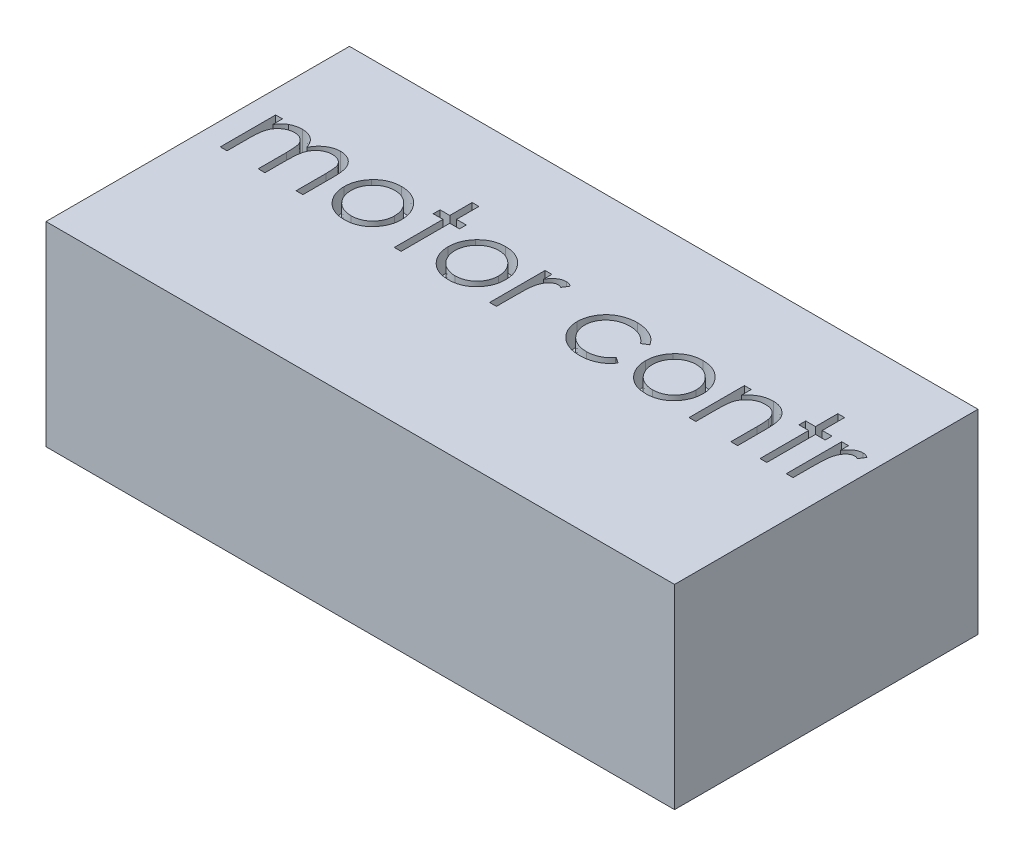
from build123d import *

# Parameters (mm, degrees)
SKETCH1_W           = 29
SKETCH1_H           = 14
BOSS_EXTRUDE1_DEPTH = 9
CUT_EXTRUDE1_DEPTH  = 1


with BuildPart() as part:
    # Sketch1 → Boss-Extrude1 (new body)
    with BuildSketch(Plane(origin=(0, 0, 0), x_dir=(1, 0, 0), z_dir=(0, 1, 0))):
        Rectangle(SKETCH1_W, SKETCH1_H)
    extrude(amount=BOSS_EXTRUDE1_DEPTH)

    # Sketch2 → Cut-Extrude1 (cut)
    # profile 1 of 10: a face of its own
    with BuildSketch(Plane(origin=(0, 9, 0), x_dir=(1, 0, 0), z_dir=(0, 1, 0))):
        with BuildLine():
            Line((-13.461538462, 2.557692308), (-13.147435897, 2.557692308))
            Line((-13.147435897, 2.557692308), (-13.147435897, 2.11318109))
            add(Edge.make_bspline(
                [(-13.147435897, 2.11318109), (-13.119151948, 2.152068691), (-13.064957188, 2.226581065), (-12.976091535, 2.324771349), (-12.887315423, 2.408099503), (-12.823382041, 2.451842375), (-12.792668269, 2.472856571)],
                knots=[0, 0, 0, 0, 1.134379233, 2.173579362, 3.122582517, 4, 4, 4, 4], degree=3))
            add(Edge.make_bspline(
                [(-12.792668269, 2.472856571), (-12.750803607, 2.492861936), (-12.667805707, 2.532523149), (-12.536386482, 2.572756708), (-12.401911813, 2.597481809), (-12.311103599, 2.600863183), (-12.265424679, 2.602564103)],
                knots=[0, 0, 0, 0, 1.014936303, 2.012140481, 3.000054389, 4, 4, 4, 4], degree=3))
            add(Edge.make_bspline(
                [(-12.265424679, 2.602564103), (-12.234531683, 2.601518812), (-12.173396104, 2.599450238), (-12.082812014, 2.585990202), (-11.994953402, 2.562724029), (-11.910339373, 2.530316705), (-11.830618693, 2.491070018), (-11.757529496, 2.445020311), (-11.691905287, 2.393323235), (-11.633779236, 2.333644302), (-11.581510211, 2.264307704), (-11.533431364, 2.183443455), (-11.489006152, 2.089235794), (-11.464384843, 2.020869253), (-11.451422276, 1.984875801)],
                knots=[0, 0, 0, 0, 1.009824226, 1.998387844, 2.986035974, 3.974953746, 4.955485308, 5.885931332, 6.793869504, 7.679848016, 8.601185859, 9.625726857, 10.749998409, 12, 12, 12, 12], degree=3))
            add(Edge.make_bspline(
                [(-11.451422276, 1.984875801), (-11.437711024, 2.009600221), (-11.410729207, 2.058254406), (-11.36542357, 2.127112668), (-11.317955774, 2.19151946), (-11.267921281, 2.251525884), (-11.215496694, 2.306835614), (-11.160435293, 2.357631516), (-11.103050512, 2.40413173), (-11.023258272, 2.458454889), (-10.919445665, 2.516156071), (-10.78855755, 2.566184515), (-10.652407378, 2.597100643), (-10.55998968, 2.600730916), (-10.513321314, 2.602564103)],
                knots=[0, 0, 0, 0, 0.86119277, 1.694706429, 2.50939023, 3.298075842, 4.073795165, 4.829715201, 5.57930267, 6.321991688, 7.768977793, 9.186738141, 10.579381044, 12, 12, 12, 12], degree=3))
            add(Edge.make_bspline(
                [(-10.513321314, 2.602564103), (-10.470439851, 2.600946882), (-10.386516665, 2.597781823), (-10.264339399, 2.57292835), (-10.150397594, 2.530250703), (-10.044920518, 2.472017066), (-9.949760704, 2.398837883), (-9.867044395, 2.311769046), (-9.797274032, 2.211426423), (-9.751695392, 2.117034434), (-9.720780128, 2.033699101), (-9.701718894, 1.96269281), (-9.684879199, 1.884541257), (-9.670897953, 1.799150995), (-9.660679401, 1.706220387), (-9.653108686, 1.605901511), (-9.647984612, 1.498116399), (-9.64762254, 1.423750899), (-9.647435897, 1.385416667)],
                knots=[0, 0, 0, 0, 1.209669288, 2.367440248, 3.500751976, 4.631527125, 5.755587489, 6.87532382, 8.007944318, 9.190864318, 9.82315674, 10.514484317, 11.263564316, 12.079023757, 12.955305781, 13.901327259, 14.918167583, 16, 16, 16, 16], degree=3))
            Line((-9.647435897, 1.385416667), (-9.647435897, 0))
            Line((-9.647435897, 0), (-9.961538462, 0))
            Line((-9.961538462, 0), (-9.961538462, 1.38681891))
            add(Edge.make_bspline(
                [(-9.961538462, 1.38681891), (-9.961616345, 1.419539484), (-9.961766024, 1.482423451), (-9.964459655, 1.572675902), (-9.969534969, 1.654944259), (-9.975469608, 1.729116348), (-9.983713418, 1.795365136), (-9.994359349, 1.853557555), (-10.005637029, 1.904151366), (-10.02437302, 1.960237414), (-10.054320912, 2.022107624), (-10.099938392, 2.0888312), (-10.157408498, 2.146912), (-10.223768655, 2.197330317), (-10.299317099, 2.238323958), (-10.382581823, 2.267599968), (-10.473045874, 2.285722846), (-10.535668663, 2.287528862), (-10.568008814, 2.288461538)],
                knots=[0, 0, 0, 0, 1.253487763, 2.409012846, 3.458416907, 4.410876679, 5.259312806, 6.014470957, 6.676830364, 7.243083969, 8.276244668, 9.299465089, 10.325150304, 11.392391894, 12.482080715, 13.603491619, 14.762376348, 16, 16, 16, 16], degree=3))
            add(Edge.make_bspline(
                [(-10.568008814, 2.288461538), (-10.607678768, 2.287045381), (-10.68608168, 2.284246516), (-10.800527166, 2.255672643), (-10.910498182, 2.212592392), (-11.012713315, 2.150159935), (-11.106741106, 2.075351571), (-11.187640684, 1.986401975), (-11.254472869, 1.885772048), (-11.299726845, 1.792625346), (-11.328316147, 1.708955902), (-11.347193062, 1.63585853), (-11.361876454, 1.552776962), (-11.375646983, 1.460269472), (-11.384634711, 1.357699291), (-11.392803083, 1.24554089), (-11.396623946, 1.123456931), (-11.397158405, 1.038830242), (-11.397435897, 0.994891827)],
                knots=[0, 0, 0, 0, 1.090531906, 2.155305635, 3.229839962, 4.33261226, 5.44038871, 6.529323825, 7.629011124, 8.757537029, 9.370236727, 10.061839251, 10.834451254, 11.692844982, 12.636905849, 13.66920014, 14.789842145, 16, 16, 16, 16], degree=3))
            Line((-11.397435897, 0.994891827), (-11.397435897, 0))
            Line((-11.397435897, 0), (-11.711538462, 0))
            Line((-11.711538462, 0), (-11.711538462, 1.300580929))
            add(Edge.make_bspline(
                [(-11.711538462, 1.300580929), (-11.711617893, 1.337274248), (-11.71177071, 1.407868505), (-11.714447027, 1.509102181), (-11.719533649, 1.601183261), (-11.725414197, 1.684004725), (-11.733874376, 1.757416053), (-11.743484138, 1.821810811), (-11.754832748, 1.877027563), (-11.773622633, 1.937590947), (-11.802337101, 2.00431187), (-11.848525363, 2.075452892), (-11.906132944, 2.137720989), (-11.973703819, 2.190879738), (-12.049709502, 2.234821219), (-12.133692902, 2.266480971), (-12.224897815, 2.28490526), (-12.287775521, 2.287253757), (-12.320112179, 2.288461538)],
                knots=[0, 0, 0, 0, 1.320475261, 2.540461679, 3.643808994, 4.639130445, 5.527981419, 6.302341397, 6.981980563, 7.553956391, 8.582137848, 9.585246428, 10.591171744, 11.620968678, 12.668337649, 13.738356861, 14.836885341, 16, 16, 16, 16], degree=3))
            add(Edge.make_bspline(
                [(-12.320112179, 2.288461538), (-12.358128391, 2.286931078), (-12.43389335, 2.283880926), (-12.54519532, 2.256426652), (-12.652681004, 2.213422577), (-12.754635702, 2.153762758), (-12.848309851, 2.07986368), (-12.930318118, 1.992948784), (-12.999260644, 1.89409975), (-13.044992458, 1.801935234), (-13.074490933, 1.720361959), (-13.094086267, 1.651011011), (-13.110925893, 1.574010763), (-13.123439915, 1.489123652), (-13.13552033, 1.396902558), (-13.141350639, 1.296888068), (-13.147022202, 1.18916598), (-13.147294616, 1.114793435), (-13.147435897, 1.076221955)],
                knots=[0, 0, 0, 0, 1.098833095, 2.189935336, 3.297829714, 4.440610912, 5.596351641, 6.740013378, 7.886572111, 9.072425424, 9.705826452, 10.395263256, 11.156850408, 11.985370555, 12.878090359, 13.847760091, 14.883794034, 16, 16, 16, 16], degree=3))
            Line((-13.147435897, 1.076221955), (-13.147435897, 0))
            Line((-13.147435897, 0), (-13.461538462, 0))
            Line((-13.461538462, 0), (-13.461538462, 2.557692308))
        make_face()
    # profile 2 of 10: a face of its own
    with BuildSketch(Plane(origin=(0, 9, 0), x_dir=(1, 0, 0), z_dir=(0, 1, 0))):
        with BuildLine():
            add(Edge.make_bspline(
                [(-7.694110577, 2.602564103), (-7.646119304, 2.601542211), (-7.552020147, 2.599538533), (-7.414212261, 2.578123567), (-7.282667125, 2.545376203), (-7.156880933, 2.500104641), (-7.038464637, 2.43942269), (-6.925693393, 2.367013399), (-6.818876384, 2.281230805), (-6.754853355, 2.214872737), (-6.722355769, 2.181189904)],
                knots=[0, 0, 0, 0, 1.054011418, 2.066658804, 3.057071809, 4.030435133, 4.997543892, 5.974964718, 6.972108034, 8, 8, 8, 8], degree=3))
            add(Edge.make_bspline(
                [(-6.722355769, 2.181189904), (-6.694373815, 2.148975918), (-6.638951435, 2.085171376), (-6.567885716, 1.981715763), (-6.506664156, 1.874575662), (-6.457601195, 1.762328336), (-6.418916171, 1.645953664), (-6.391450475, 1.525051653), (-6.37511354, 1.399889306), (-6.372910573, 1.314885468), (-6.371794872, 1.271834936)],
                knots=[0, 0, 0, 0, 1.025258237, 2.030674902, 3.01204498, 3.988269485, 4.97094183, 5.956517959, 6.965070386, 8, 8, 8, 8], degree=3))
            add(Edge.make_bspline(
                [(-6.371794872, 1.271834936), (-6.372776209, 1.228534878), (-6.374715377, 1.142971945), (-6.393058994, 1.016952579), (-6.42159008, 0.894757756), (-6.462421918, 0.776899063), (-6.514780027, 0.663016235), (-6.578670715, 0.553606686), (-6.654542332, 0.448454553), (-6.740546329, 0.348452714), (-6.835598205, 0.2562865), (-6.938714353, 0.17595823), (-7.047868387, 0.107136706), (-7.16451174, 0.05170029), (-7.287579227, 0.00799059), (-7.417336295, -0.022709427), (-7.553581365, -0.04127111), (-7.646608587, -0.043654684), (-7.694110577, -0.044871795)],
                knots=[0, 0, 0, 0, 0.998656419, 1.973391657, 2.932242238, 3.890759089, 4.846373663, 5.82037756, 6.809684879, 7.83454468, 8.860553229, 9.859544525, 10.845671541, 11.83227036, 12.833544569, 13.85385346, 14.904124723, 16, 16, 16, 16], degree=3))
            add(Edge.make_bspline(
                [(-7.694110577, -0.044871795), (-7.741845296, -0.043650599), (-7.835336156, -0.041258824), (-7.972062138, -0.022781541), (-8.102051757, 0.007976441), (-8.225280356, 0.051843934), (-8.342425202, 0.107138478), (-8.452211699, 0.175750167), (-8.555411615, 0.256310322), (-8.650483599, 0.348446259), (-8.736482205, 0.448456216), (-8.812355213, 0.553606254), (-8.876245539, 0.663016348), (-8.928603743, 0.776899033), (-8.969435556, 0.894757764), (-8.997966649, 1.016952577), (-9.016310263, 1.142971945), (-9.018249432, 1.228534878), (-9.019230769, 1.271834936)],
                knots=[0, 0, 0, 0, 1.099876186, 2.154163076, 3.173186993, 4.173200201, 5.163417411, 6.152872554, 7.150605724, 8.17532212, 9.198891216, 10.186952605, 11.159729845, 12.11414092, 13.071450619, 14.029093627, 15.002601286, 16, 16, 16, 16], degree=3))
            add(Edge.make_bspline(
                [(-9.019230769, 1.271834936), (-9.018107459, 1.314651482), (-9.015883497, 1.399420884), (-8.999562988, 1.524347945), (-8.972204432, 1.645045334), (-8.933473035, 1.76097081), (-8.883957845, 1.872726246), (-8.823596557, 1.980131077), (-8.751805924, 2.083118877), (-8.696603973, 2.146840957), (-8.668669872, 2.179086538)],
                knots=[0, 0, 0, 0, 1.031353054, 2.041901799, 3.029428768, 4.008703097, 4.981709435, 5.96992636, 6.972712378, 8, 8, 8, 8], degree=3))
            add(Edge.make_bspline(
                [(-8.668669872, 2.179086538), (-8.636221281, 2.213061478), (-8.572405417, 2.279879174), (-8.465056689, 2.365411698), (-8.352562868, 2.439327772), (-8.232837942, 2.498803987), (-8.107155084, 2.545642505), (-7.974935841, 2.57820802), (-7.836660326, 2.599461375), (-7.742100705, 2.601519553), (-7.694110577, 2.602564103)],
                knots=[0, 0, 0, 0, 1.027980169, 2.021703884, 2.998553061, 3.971491411, 4.943284454, 5.930300938, 6.949603206, 8, 8, 8, 8], degree=3))
        make_face()
        with BuildLine():
            add(Edge.make_bspline(
                [(-7.695512821, 2.288461538), (-7.729450432, 2.287496947), (-7.796449561, 2.285592664), (-7.895069145, 2.27110876), (-7.990009299, 2.248161255), (-8.081450143, 2.215557199), (-8.169083316, 2.1734583), (-8.252992718, 2.12174994), (-8.333425158, 2.061116984), (-8.408807221, 1.991654312), (-8.477989534, 1.915775317), (-8.53846751, 1.834926959), (-8.589892616, 1.750420612), (-8.632732775, 1.662168401), (-8.664639964, 1.569275987), (-8.687812986, 1.472795356), (-8.702283226, 1.37252994), (-8.704169605, 1.304368921), (-8.705128205, 1.269731571)],
                knots=[0, 0, 0, 0, 1.021534396, 2.016698045, 2.994645724, 3.958388632, 4.93408049, 5.916473867, 6.921342795, 7.962252576, 8.998418191, 10.008913653, 10.997312074, 11.973003931, 12.956656626, 13.948281152, 14.957379055, 16, 16, 16, 16], degree=3))
            add(Edge.make_bspline(
                [(-8.705128205, 1.269731571), (-8.703521381, 1.224979543), (-8.700332137, 1.136155138), (-8.674396901, 1.005344015), (-8.631010621, 0.879762163), (-8.572423341, 0.760145777), (-8.499017122, 0.649473499), (-8.412530056, 0.550802015), (-8.313890355, 0.465616203), (-8.204273855, 0.394935358), (-8.085919537, 0.338775602), (-7.960663216, 0.298976626), (-7.830022522, 0.273104934), (-7.740741791, 0.270533459), (-7.695512821, 0.269230769)],
                knots=[0, 0, 0, 0, 1.016792936, 2.018143844, 3.017858371, 4.030088057, 5.03801393, 6.028138512, 7.003788237, 7.991172063, 8.984598303, 9.972568034, 10.972917682, 12, 12, 12, 12], degree=3))
            add(Edge.make_bspline(
                [(-7.695512821, 0.269230769), (-7.650286452, 0.270541049), (-7.561010856, 0.273127506), (-7.430551679, 0.298846326), (-7.305637707, 0.338949987), (-7.187406319, 0.394872197), (-7.077839716, 0.465884611), (-6.978490595, 0.550320988), (-6.892741983, 0.64973484), (-6.819408379, 0.760292369), (-6.759861636, 0.879576721), (-6.716678434, 1.005367193), (-6.690680848, 1.136149235), (-6.687500019, 1.224977566), (-6.685897436, 1.269731571)],
                knots=[0, 0, 0, 0, 1.02726834, 2.027799167, 3.010890988, 4.004497153, 4.992059811, 5.971914811, 6.958719428, 7.966827853, 8.981595046, 9.981490638, 10.983022906, 12, 12, 12, 12], degree=3))
            add(Edge.make_bspline(
                [(-6.685897436, 1.269731571), (-6.686855706, 1.304369128), (-6.688741435, 1.372530554), (-6.703216399, 1.472793007), (-6.726371939, 1.569284604), (-6.758343556, 1.662136607), (-6.80099757, 1.750649112), (-6.853414363, 1.834678839), (-6.913645389, 1.916055385), (-6.98366251, 1.991409026), (-7.058965887, 2.061144062), (-7.139430926, 2.121773452), (-7.223215904, 2.173231047), (-7.310594487, 2.215917288), (-7.402047055, 2.247864628), (-7.496854184, 2.271241259), (-7.595052994, 2.285531456), (-7.661812037, 2.287478598), (-7.695512821, 2.288461538)],
                knots=[0, 0, 0, 0, 1.042956736, 2.052379634, 3.044323526, 4.02829302, 5.004299113, 5.996692471, 7.007513377, 8.048758398, 9.090003419, 10.095195979, 11.07790575, 12.047570684, 13.018257071, 13.989683339, 14.985167495, 16, 16, 16, 16], degree=3))
        make_face(mode=Mode.SUBTRACT)
    # profile 3 of 10: a face of its own
    with BuildSketch(Plane(origin=(0, 9, 0), x_dir=(1, 0, 0), z_dir=(0, 1, 0))):
        Polygon((-5.429487179, 3.58974359), (-5.115384615, 3.58974359), (-5.115384615, 2.557692308), (-4.666666667, 2.557692308), (-4.666666667, 2.243589744), (-5.115384615, 2.243589744), (-5.115384615, 0), (-5.429487179, 0), (-5.429487179, 2.243589744), (-5.878205128, 2.243589744), (-5.878205128, 2.557692308), (-5.429487179, 2.557692308), align=None)
    # profile 4 of 10: a face of its own
    with BuildSketch(Plane(origin=(0, 9, 0), x_dir=(1, 0, 0), z_dir=(0, 1, 0))):
        with BuildLine():
            add(Edge.make_bspline(
                [(-2.892828526, 2.602564103), (-2.844837253, 2.601542211), (-2.750738095, 2.599538533), (-2.612930209, 2.578123567), (-2.481385073, 2.545376203), (-2.355598881, 2.500104641), (-2.237182586, 2.43942269), (-2.124411342, 2.367013399), (-2.017594333, 2.281230805), (-1.953571304, 2.214872737), (-1.921073718, 2.181189904)],
                knots=[0, 0, 0, 0, 1.054011418, 2.066658804, 3.057071809, 4.030435133, 4.997543892, 5.974964718, 6.972108034, 8, 8, 8, 8], degree=3))
            add(Edge.make_bspline(
                [(-1.921073718, 2.181189904), (-1.893091764, 2.148975918), (-1.837669384, 2.085171376), (-1.766603665, 1.981715763), (-1.705382105, 1.874575662), (-1.656319144, 1.762328336), (-1.61763412, 1.645953664), (-1.590168424, 1.525051653), (-1.573831489, 1.399889306), (-1.571628522, 1.314885468), (-1.570512821, 1.271834936)],
                knots=[0, 0, 0, 0, 1.025258237, 2.030674902, 3.01204498, 3.988269485, 4.97094183, 5.956517959, 6.965070386, 8, 8, 8, 8], degree=3))
            add(Edge.make_bspline(
                [(-1.570512821, 1.271834936), (-1.571494158, 1.228534878), (-1.573433326, 1.142971945), (-1.591776943, 1.016952579), (-1.620308028, 0.894757756), (-1.661139867, 0.776899063), (-1.713497976, 0.663016235), (-1.777388663, 0.553606686), (-1.853260281, 0.448454553), (-1.939264277, 0.348452714), (-2.034316153, 0.2562865), (-2.137432302, 0.17595823), (-2.246586336, 0.107136706), (-2.363229689, 0.05170029), (-2.486297176, 0.00799059), (-2.616054244, -0.022709427), (-2.752299314, -0.04127111), (-2.845326535, -0.043654684), (-2.892828526, -0.044871795)],
                knots=[0, 0, 0, 0, 0.998656419, 1.973391657, 2.932242238, 3.890759089, 4.846373663, 5.82037756, 6.809684879, 7.83454468, 8.860553229, 9.859544525, 10.845671541, 11.83227036, 12.833544569, 13.85385346, 14.904124723, 16, 16, 16, 16], degree=3))
            add(Edge.make_bspline(
                [(-2.892828526, -0.044871795), (-2.940563245, -0.043650599), (-3.034054105, -0.041258824), (-3.170780087, -0.022781541), (-3.300769706, 0.007976441), (-3.423998304, 0.051843934), (-3.541143151, 0.107138478), (-3.650929648, 0.175750167), (-3.754129564, 0.256310322), (-3.849201548, 0.348446259), (-3.935200153, 0.448456216), (-4.011073162, 0.553606254), (-4.074963488, 0.663016348), (-4.127321692, 0.776899033), (-4.168153505, 0.894757764), (-4.196684597, 1.016952577), (-4.215028212, 1.142971945), (-4.216967381, 1.228534878), (-4.217948718, 1.271834936)],
                knots=[0, 0, 0, 0, 1.099876186, 2.154163076, 3.173186993, 4.173200201, 5.163417411, 6.152872554, 7.150605724, 8.17532212, 9.198891216, 10.186952605, 11.159729845, 12.11414092, 13.071450619, 14.029093627, 15.002601286, 16, 16, 16, 16], degree=3))
            add(Edge.make_bspline(
                [(-4.217948718, 1.271834936), (-4.216825408, 1.314651482), (-4.214601446, 1.399420884), (-4.198280937, 1.524347945), (-4.170922381, 1.645045334), (-4.132190984, 1.76097081), (-4.082675793, 1.872726246), (-4.022314505, 1.980131077), (-3.950523873, 2.083118877), (-3.895321921, 2.146840957), (-3.867387821, 2.179086538)],
                knots=[0, 0, 0, 0, 1.031353054, 2.041901799, 3.029428768, 4.008703097, 4.981709435, 5.96992636, 6.972712378, 8, 8, 8, 8], degree=3))
            add(Edge.make_bspline(
                [(-3.867387821, 2.179086538), (-3.834939229, 2.213061478), (-3.771123366, 2.279879174), (-3.663774638, 2.365411698), (-3.551280817, 2.439327772), (-3.431555891, 2.498803987), (-3.305873033, 2.545642505), (-3.17365379, 2.57820802), (-3.035378275, 2.599461375), (-2.940818654, 2.601519553), (-2.892828526, 2.602564103)],
                knots=[0, 0, 0, 0, 1.027980169, 2.021703884, 2.998553061, 3.971491411, 4.943284454, 5.930300938, 6.949603206, 8, 8, 8, 8], degree=3))
        make_face()
        with BuildLine():
            add(Edge.make_bspline(
                [(-2.894230769, 2.288461538), (-2.928168381, 2.287496947), (-2.995167509, 2.285592664), (-3.093787094, 2.27110876), (-3.188727248, 2.248161255), (-3.280168092, 2.215557199), (-3.367801264, 2.1734583), (-3.451710667, 2.12174994), (-3.532143107, 2.061116984), (-3.60752517, 1.991654312), (-3.676707482, 1.915775317), (-3.737185459, 1.834926959), (-3.788610565, 1.750420612), (-3.831450724, 1.662168401), (-3.863357912, 1.569275987), (-3.886530935, 1.472795356), (-3.901001175, 1.37252994), (-3.902887554, 1.304368921), (-3.903846154, 1.269731571)],
                knots=[0, 0, 0, 0, 1.021534396, 2.016698045, 2.994645724, 3.958388632, 4.93408049, 5.916473867, 6.921342795, 7.962252576, 8.998418191, 10.008913653, 10.997312074, 11.973003931, 12.956656626, 13.948281152, 14.957379055, 16, 16, 16, 16], degree=3))
            add(Edge.make_bspline(
                [(-3.903846154, 1.269731571), (-3.90223933, 1.224979543), (-3.899050086, 1.136155138), (-3.873114849, 1.005344015), (-3.829728569, 0.879762163), (-3.77114129, 0.760145777), (-3.697735071, 0.649473499), (-3.611248004, 0.550802015), (-3.512608304, 0.465616203), (-3.402991804, 0.394935358), (-3.284637486, 0.338775602), (-3.159381165, 0.298976626), (-3.028740471, 0.273104934), (-2.93945974, 0.270533459), (-2.894230769, 0.269230769)],
                knots=[0, 0, 0, 0, 1.016792936, 2.018143844, 3.017858371, 4.030088057, 5.03801393, 6.028138512, 7.003788237, 7.991172063, 8.984598303, 9.972568034, 10.972917682, 12, 12, 12, 12], degree=3))
            add(Edge.make_bspline(
                [(-2.894230769, 0.269230769), (-2.8490044, 0.270541049), (-2.759728804, 0.273127506), (-2.629269627, 0.298846326), (-2.504355656, 0.338949987), (-2.386124268, 0.394872197), (-2.276557665, 0.465884611), (-2.177208543, 0.550320988), (-2.091459932, 0.64973484), (-2.018126327, 0.760292369), (-1.958579585, 0.879576721), (-1.915396383, 1.005367193), (-1.889398797, 1.136149235), (-1.886217968, 1.224977566), (-1.884615385, 1.269731571)],
                knots=[0, 0, 0, 0, 1.02726834, 2.027799167, 3.010890988, 4.004497153, 4.992059811, 5.971914811, 6.958719428, 7.966827853, 8.981595046, 9.981490638, 10.983022906, 12, 12, 12, 12], degree=3))
            add(Edge.make_bspline(
                [(-1.884615385, 1.269731571), (-1.885573655, 1.304369128), (-1.887459384, 1.372530554), (-1.901934348, 1.472793007), (-1.925089888, 1.569284604), (-1.957061505, 1.662136607), (-1.999715519, 1.750649112), (-2.052132312, 1.834678839), (-2.112363337, 1.916055385), (-2.182380458, 1.991409026), (-2.257683836, 2.061144062), (-2.338148874, 2.121773452), (-2.421933853, 2.173231047), (-2.509312436, 2.215917288), (-2.600765003, 2.247864628), (-2.695572132, 2.271241259), (-2.793770942, 2.285531456), (-2.860529986, 2.287478598), (-2.894230769, 2.288461538)],
                knots=[0, 0, 0, 0, 1.042956736, 2.052379634, 3.044323526, 4.02829302, 5.004299113, 5.996692471, 7.007513377, 8.048758398, 9.090003419, 10.095195979, 11.07790575, 12.047570684, 13.018257071, 13.989683339, 14.985167495, 16, 16, 16, 16], degree=3))
        make_face(mode=Mode.SUBTRACT)
    # profile 5 of 10: a face of its own
    with BuildSketch(Plane(origin=(0, 9, 0), x_dir=(1, 0, 0), z_dir=(0, 1, 0))):
        with BuildLine():
            Line((-1.032051282, 2.557692308), (-0.717948718, 2.557692308))
            Line((-0.717948718, 2.557692308), (-0.717948718, 2.181189904))
            add(Edge.make_bspline(
                [(-0.717948718, 2.181189904), (-0.694759959, 2.216245732), (-0.650411638, 2.283289731), (-0.576698709, 2.371959032), (-0.501195378, 2.445374079), (-0.42354019, 2.503877598), (-0.34316209, 2.547690717), (-0.261825139, 2.579783752), (-0.178249669, 2.598761067), (-0.122087745, 2.601294726), (-0.093950321, 2.602564103)],
                knots=[0, 0, 0, 0, 1.2804753, 2.448899062, 3.506932113, 4.484331642, 5.4025378, 6.288909075, 7.142734305, 8, 8, 8, 8], degree=3))
            add(Edge.make_bspline(
                [(-0.093950321, 2.602564103), (-0.072123994, 2.601373576), (-0.027214909, 2.59892399), (0.040767681, 2.581713165), (0.110811133, 2.554235143), (0.15595352, 2.52839492), (0.179487179, 2.514923878)],
                knots=[0, 0, 0, 0, 0.901110191, 1.854092781, 2.881294221, 4, 4, 4, 4], degree=3))
            Line((0.179487179, 2.514923878), (0.007011218, 2.242888622))
            add(Edge.make_bspline(
                [(0.007011218, 2.242888622), (-0.008097803, 2.249628888), (-0.036777618, 2.262423203), (-0.078732184, 2.277565213), (-0.117413521, 2.286481129), (-0.142057079, 2.287831847), (-0.153545673, 2.288461538)],
                knots=[0, 0, 0, 0, 1.180555205, 2.24091978, 3.179933427, 4, 4, 4, 4], degree=3))
            add(Edge.make_bspline(
                [(-0.153545673, 2.288461538), (-0.178751407, 2.286781501), (-0.230163797, 2.283354712), (-0.305648296, 2.256415904), (-0.378895501, 2.212890664), (-0.437067164, 2.164619552), (-0.482109417, 2.118071755), (-0.514249642, 2.077423352), (-0.543732389, 2.031844721), (-0.57190261, 1.982115037), (-0.597568904, 1.927385191), (-0.621523573, 1.868201977), (-0.643182436, 1.804496849), (-0.65553268, 1.760114328), (-0.661858974, 1.737379808)],
                knots=[0, 0, 0, 0, 1.125678352, 2.296057538, 3.5422874, 4.923748041, 5.663163013, 6.437101912, 7.23742474, 8.08941207, 8.991984279, 9.93940061, 10.944477711, 12, 12, 12, 12], degree=3))
            add(Edge.make_bspline(
                [(-0.661858974, 1.737379808), (-0.666591368, 1.717102634), (-0.677073259, 1.672190235), (-0.687264797, 1.596841711), (-0.697334315, 1.507818052), (-0.704430934, 1.404871459), (-0.711008976, 1.288259015), (-0.714719058, 1.15780307), (-0.717822199, 1.013369718), (-0.717905265, 0.912395365), (-0.717948718, 0.859575321)],
                knots=[0, 0, 0, 0, 0.566838948, 1.255505196, 2.06880316, 3.007127437, 4.065329342, 5.249902469, 6.561414163, 8, 8, 8, 8], degree=3))
            Line((-0.717948718, 0.859575321), (-0.717948718, 0))
            Line((-0.717948718, 0), (-1.032051282, 0))
            Line((-1.032051282, 0), (-1.032051282, 2.557692308))
        make_face()
    # profile 6 of 10: a face of its own
    with BuildSketch(Plane(origin=(0, 9, 0), x_dir=(1, 0, 0), z_dir=(0, 1, 0))):
        with BuildLine():
            Line((4.352564103, 2.003104968), (4.089643429, 1.83974359))
            add(Edge.make_bspline(
                [(4.089643429, 1.83974359), (4.060813564, 1.875571984), (4.004066869, 1.946094094), (3.905527633, 2.037104027), (3.800516218, 2.115271069), (3.687238171, 2.17897482), (3.565852371, 2.22819627), (3.436837519, 2.263026476), (3.300212014, 2.284730719), (3.206546815, 2.287197555), (3.158553686, 2.288461538)],
                knots=[0, 0, 0, 0, 1.026593902, 2.0206758, 2.988051866, 3.946915611, 4.916868779, 5.907761954, 6.927957743, 8, 8, 8, 8], degree=3))
            add(Edge.make_bspline(
                [(3.158553686, 2.288461538), (3.120194729, 2.287404696), (3.044647806, 2.285323274), (2.933741653, 2.272312781), (2.8280993, 2.248670773), (2.727058591, 2.217519816), (2.631338172, 2.175769526), (2.540687254, 2.12495977), (2.454301764, 2.06590973), (2.374685023, 1.997499184), (2.301856015, 1.923100516), (2.238757101, 1.843346821), (2.183820168, 1.76062693), (2.140714212, 1.672875188), (2.105439041, 1.582099134), (2.082232321, 1.486585279), (2.066767626, 1.387557271), (2.064998297, 1.320038931), (2.064102564, 1.285857372)],
                knots=[0, 0, 0, 0, 1.112346261, 2.190735716, 3.231507886, 4.247384806, 5.251966152, 6.253067467, 7.256802811, 8.280671706, 9.291813951, 10.270744147, 11.225547591, 12.165006084, 13.100104208, 14.043489273, 15.009504848, 16, 16, 16, 16], degree=3))
            add(Edge.make_bspline(
                [(2.064102564, 1.285857372), (2.065881816, 1.241088161), (2.069416347, 1.152152965), (2.097117807, 1.020874863), (2.142462214, 0.893951173), (2.204520065, 0.772283036), (2.282997199, 0.65968888), (2.375169762, 0.558705426), (2.481088846, 0.471289398), (2.599821176, 0.398816873), (2.72857892, 0.340555505), (2.865969024, 0.299048172), (3.010868805, 0.2739958), (3.110075552, 0.270839857), (3.160657051, 0.269230769)],
                knots=[0, 0, 0, 0, 0.966302908, 1.919585723, 2.883856336, 3.870342332, 4.860282998, 5.839159637, 6.814385684, 7.815993281, 8.834850808, 9.858348828, 10.908058873, 12, 12, 12, 12], degree=3))
            add(Edge.make_bspline(
                [(3.160657051, 0.269230769), (3.207012236, 0.270530266), (3.298112474, 0.273084123), (3.431279759, 0.294613087), (3.55805967, 0.32985672), (3.678447701, 0.37900437), (3.792223867, 0.442531886), (3.898653042, 0.520891057), (3.99985298, 0.611827657), (4.059349956, 0.682145629), (4.089643429, 0.717948718)],
                knots=[0, 0, 0, 0, 1.039848629, 2.043578496, 3.018386758, 3.987534228, 4.954977003, 5.934852016, 6.948509513, 8, 8, 8, 8], degree=3))
            Line((4.089643429, 0.717948718), (4.352564103, 0.545472756))
            add(Edge.make_bspline(
                [(4.352564103, 0.545472756), (4.3369764, 0.522582029), (4.305852733, 0.476876553), (4.253825108, 0.412432436), (4.197705276, 0.352110754), (4.137712179, 0.295992364), (4.07462917, 0.242734345), (4.00630126, 0.19488277), (3.934931649, 0.149747947), (3.859682491, 0.109135075), (3.781331793, 0.072628754), (3.699989803, 0.041237583), (3.61600999, 0.014267477), (3.529293614, -0.00716987), (3.439669716, -0.024280708), (3.347370082, -0.03563441), (3.2524265, -0.044109691), (3.188254349, -0.044615558), (3.155749199, -0.044871795)],
                knots=[0, 0, 0, 0, 0.954134338, 1.905101784, 2.851144739, 3.791306361, 4.734911809, 5.6936923, 6.663572882, 7.643865596, 8.638447847, 9.640600242, 10.646758161, 11.676244097, 12.717260333, 13.78922464, 14.880174919, 16, 16, 16, 16], degree=3))
            add(Edge.make_bspline(
                [(3.155749199, -0.044871795), (3.106138315, -0.043980515), (3.008900623, -0.0422336), (2.866578115, -0.023025125), (2.730564448, 0.005932491), (2.60090609, 0.047496225), (2.477582856, 0.101001001), (2.360709738, 0.166357915), (2.250673719, 0.244109705), (2.148562937, 0.332872475), (2.054781491, 0.429113115), (1.9742553, 0.532963033), (1.90441003, 0.640604081), (1.848322487, 0.754413607), (1.80367556, 0.87287898), (1.773170727, 0.99694922), (1.75344099, 1.125601474), (1.75115761, 1.213334356), (1.75, 1.2578125)],
                knots=[0, 0, 0, 0, 1.1129367, 2.181364009, 3.217532258, 4.231199276, 5.232079859, 6.230262199, 7.231623845, 8.250719726, 9.263571943, 10.242672461, 11.195837495, 12.138959767, 13.085126421, 14.0317438, 15.002148558, 16, 16, 16, 16], degree=3))
            add(Edge.make_bspline(
                [(1.75, 1.2578125), (1.750441016, 1.287990935), (1.75131827, 1.348020822), (1.761380198, 1.437115889), (1.774378671, 1.525024434), (1.796404408, 1.610632153), (1.821845039, 1.695237443), (1.854320571, 1.777820545), (1.892415966, 1.858765217), (1.935667913, 1.937862947), (1.984356659, 2.013812487), (2.038237892, 2.085566151), (2.095282228, 2.153985917), (2.15815834, 2.216709677), (2.224197994, 2.276245869), (2.29526957, 2.331003993), (2.370965421, 2.381144984), (2.450148744, 2.427595999), (2.532773455, 2.468955434), (2.618340126, 2.504588672), (2.706333155, 2.535041248), (2.796893299, 2.559150167), (2.889419472, 2.579367591), (2.98464081, 2.592085437), (3.082193032, 2.60107171), (3.148249055, 2.602062502), (3.181690705, 2.602564103)],
                knots=[0, 0, 0, 0, 0.990994727, 1.971252077, 2.943264845, 3.907940874, 4.872158414, 5.844625996, 6.82015047, 7.809835459, 8.804511986, 9.781214284, 10.756496977, 11.728388426, 12.696359165, 13.676225489, 14.672885716, 15.677705647, 16.690706858, 17.706033469, 18.721040654, 19.747369689, 20.783475414, 21.830280724, 22.901553713, 24, 24, 24, 24], degree=3))
            add(Edge.make_bspline(
                [(3.181690705, 2.602564103), (3.223570813, 2.601642212), (3.307121693, 2.599803037), (3.431062399, 2.584324385), (3.553177593, 2.560987969), (3.671324697, 2.526415139), (3.784071211, 2.484551483), (3.889606661, 2.437538769), (3.985446765, 2.382944165), (4.073374354, 2.323224051), (4.153553872, 2.255863145), (4.226808364, 2.180056188), (4.294640014, 2.096197709), (4.333096725, 2.034391978), (4.352564103, 2.003104968)],
                knots=[0, 0, 0, 0, 1.095225653, 2.184976855, 3.262915854, 4.344593502, 5.400796181, 6.407717688, 7.363229445, 8.282371371, 9.184954523, 10.097238608, 11.036792983, 12, 12, 12, 12], degree=3))
        make_face()
    # profile 7 of 10: a face of its own
    with BuildSketch(Plane(origin=(0, 9, 0), x_dir=(1, 0, 0), z_dir=(0, 1, 0))):
        with BuildLine():
            add(Edge.make_bspline(
                [(6.216145833, 2.602564103), (6.264137106, 2.601542211), (6.358236264, 2.599538533), (6.49604415, 2.578123567), (6.627589286, 2.545376203), (6.753375478, 2.500104641), (6.871791773, 2.43942269), (6.984563017, 2.367013399), (7.091380026, 2.281230805), (7.155403055, 2.214872737), (7.187900641, 2.181189904)],
                knots=[0, 0, 0, 0, 1.054011418, 2.066658804, 3.057071809, 4.030435133, 4.997543892, 5.974964718, 6.972108034, 8, 8, 8, 8], degree=3))
            add(Edge.make_bspline(
                [(7.187900641, 2.181189904), (7.215882595, 2.148975918), (7.271304975, 2.085171376), (7.342370694, 1.981715763), (7.403592254, 1.874575662), (7.452655215, 1.762328336), (7.491340239, 1.645953664), (7.518805935, 1.525051653), (7.53514287, 1.399889306), (7.537345837, 1.314885468), (7.538461538, 1.271834936)],
                knots=[0, 0, 0, 0, 1.025258237, 2.030674902, 3.01204498, 3.988269485, 4.97094183, 5.956517959, 6.965070386, 8, 8, 8, 8], degree=3))
            add(Edge.make_bspline(
                [(7.538461538, 1.271834936), (7.537480201, 1.228534878), (7.535541033, 1.142971945), (7.517197416, 1.016952579), (7.488666331, 0.894757756), (7.447834492, 0.776899063), (7.395476383, 0.663016235), (7.331585696, 0.553606686), (7.255714078, 0.448454553), (7.169710082, 0.348452714), (7.074658206, 0.2562865), (6.971542057, 0.17595823), (6.862388023, 0.107136706), (6.74574467, 0.05170029), (6.622677183, 0.00799059), (6.492920115, -0.022709427), (6.356675045, -0.04127111), (6.263647824, -0.043654684), (6.216145833, -0.044871795)],
                knots=[0, 0, 0, 0, 0.998656419, 1.973391657, 2.932242238, 3.890759089, 4.846373663, 5.82037756, 6.809684879, 7.83454468, 8.860553229, 9.859544525, 10.845671541, 11.83227036, 12.833544569, 13.85385346, 14.904124723, 16, 16, 16, 16], degree=3))
            add(Edge.make_bspline(
                [(6.216145833, -0.044871795), (6.168411114, -0.043650599), (6.074920254, -0.041258824), (5.938194272, -0.022781541), (5.808204653, 0.007976441), (5.684976055, 0.051843934), (5.567831208, 0.107138478), (5.458044711, 0.175750167), (5.354844795, 0.256310322), (5.259772811, 0.348446259), (5.173774206, 0.448456216), (5.097901197, 0.553606254), (5.034010871, 0.663016348), (4.981652667, 0.776899033), (4.940820854, 0.894757764), (4.912289762, 1.016952577), (4.893946147, 1.142971945), (4.892006978, 1.228534878), (4.891025641, 1.271834936)],
                knots=[0, 0, 0, 0, 1.099876186, 2.154163076, 3.173186993, 4.173200201, 5.163417411, 6.152872554, 7.150605724, 8.17532212, 9.198891216, 10.186952605, 11.159729845, 12.11414092, 13.071450619, 14.029093627, 15.002601286, 16, 16, 16, 16], degree=3))
            add(Edge.make_bspline(
                [(4.891025641, 1.271834936), (4.892148951, 1.314651482), (4.894372913, 1.399420884), (4.910693422, 1.524347945), (4.938051978, 1.645045334), (4.976783375, 1.76097081), (5.026298566, 1.872726246), (5.086659854, 1.980131077), (5.158450486, 2.083118877), (5.213652438, 2.146840957), (5.241586538, 2.179086538)],
                knots=[0, 0, 0, 0, 1.031353054, 2.041901799, 3.029428768, 4.008703097, 4.981709435, 5.96992636, 6.972712378, 8, 8, 8, 8], degree=3))
            add(Edge.make_bspline(
                [(5.241586538, 2.179086538), (5.274035129, 2.213061478), (5.337850993, 2.279879174), (5.445199721, 2.365411698), (5.557693542, 2.439327772), (5.677418468, 2.498803987), (5.803101326, 2.545642505), (5.935320569, 2.57820802), (6.073596084, 2.599461375), (6.168155705, 2.601519553), (6.216145833, 2.602564103)],
                knots=[0, 0, 0, 0, 1.027980169, 2.021703884, 2.998553061, 3.971491411, 4.943284454, 5.930300938, 6.949603206, 8, 8, 8, 8], degree=3))
        make_face()
        with BuildLine():
            add(Edge.make_bspline(
                [(6.21474359, 2.288461538), (6.180805978, 2.287496947), (6.11380685, 2.285592664), (6.015187265, 2.27110876), (5.920247111, 2.248161255), (5.828806267, 2.215557199), (5.741173095, 2.1734583), (5.657263692, 2.12174994), (5.576831252, 2.061116984), (5.501449189, 1.991654312), (5.432266877, 1.915775317), (5.3717889, 1.834926959), (5.320363794, 1.750420612), (5.277523635, 1.662168401), (5.245616447, 1.569275987), (5.222443424, 1.472795356), (5.207973184, 1.37252994), (5.206086805, 1.304368921), (5.205128205, 1.269731571)],
                knots=[0, 0, 0, 0, 1.021534396, 2.016698045, 2.994645724, 3.958388632, 4.93408049, 5.916473867, 6.921342795, 7.962252576, 8.998418191, 10.008913653, 10.997312074, 11.973003931, 12.956656626, 13.948281152, 14.957379055, 16, 16, 16, 16], degree=3))
            add(Edge.make_bspline(
                [(5.205128205, 1.269731571), (5.206735029, 1.224979543), (5.209924273, 1.136155138), (5.23585951, 1.005344015), (5.27924579, 0.879762163), (5.337833069, 0.760145777), (5.411239288, 0.649473499), (5.497726355, 0.550802015), (5.596366055, 0.465616203), (5.705982555, 0.394935358), (5.824336873, 0.338775602), (5.949593194, 0.298976626), (6.080233888, 0.273104934), (6.169514619, 0.270533459), (6.21474359, 0.269230769)],
                knots=[0, 0, 0, 0, 1.016792936, 2.018143844, 3.017858371, 4.030088057, 5.03801393, 6.028138512, 7.003788237, 7.991172063, 8.984598303, 9.972568034, 10.972917682, 12, 12, 12, 12], degree=3))
            add(Edge.make_bspline(
                [(6.21474359, 0.269230769), (6.259969959, 0.270541049), (6.349245555, 0.273127506), (6.479704731, 0.298846326), (6.604618703, 0.338949987), (6.722850091, 0.394872197), (6.832416694, 0.465884611), (6.931765816, 0.550320988), (7.017514427, 0.64973484), (7.090848032, 0.760292369), (7.150394774, 0.879576721), (7.193577976, 1.005367193), (7.219575562, 1.136149235), (7.222756391, 1.224977566), (7.224358974, 1.269731571)],
                knots=[0, 0, 0, 0, 1.02726834, 2.027799167, 3.010890988, 4.004497153, 4.992059811, 5.971914811, 6.958719428, 7.966827853, 8.981595046, 9.981490638, 10.983022906, 12, 12, 12, 12], degree=3))
            add(Edge.make_bspline(
                [(7.224358974, 1.269731571), (7.223400704, 1.304369128), (7.221514975, 1.372530554), (7.207040011, 1.472793007), (7.183884471, 1.569284604), (7.151912854, 1.662136607), (7.10925884, 1.750649112), (7.056842047, 1.834678839), (6.996611022, 1.916055385), (6.926593901, 1.991409026), (6.851290523, 2.061144062), (6.770825485, 2.121773452), (6.687040506, 2.173231047), (6.599661923, 2.215917288), (6.508209356, 2.247864628), (6.413402227, 2.271241259), (6.315203417, 2.285531456), (6.248444373, 2.287478598), (6.21474359, 2.288461538)],
                knots=[0, 0, 0, 0, 1.042956736, 2.052379634, 3.044323526, 4.02829302, 5.004299113, 5.996692471, 7.007513377, 8.048758398, 9.090003419, 10.095195979, 11.07790575, 12.047570684, 13.018257071, 13.989683339, 14.985167495, 16, 16, 16, 16], degree=3))
        make_face(mode=Mode.SUBTRACT)
    # profile 8 of 10: a face of its own
    with BuildSketch(Plane(origin=(0, 9, 0), x_dir=(1, 0, 0), z_dir=(0, 1, 0))):
        with BuildLine():
            Line((8.166666667, 2.557692308), (8.480769231, 2.557692308))
            Line((8.480769231, 2.557692308), (8.480769231, 2.096354167))
            add(Edge.make_bspline(
                [(8.480769231, 2.096354167), (8.514306866, 2.13819689), (8.579387817, 2.219394153), (8.68777215, 2.326114728), (8.802316051, 2.414059953), (8.922318054, 2.484163747), (9.047941064, 2.537010373), (9.178419334, 2.575176304), (9.31453404, 2.598061132), (9.407098477, 2.601051363), (9.453926282, 2.602564103)],
                knots=[0, 0, 0, 0, 1.12780773, 2.188550248, 3.19190651, 4.159438251, 5.104880172, 6.052711206, 7.014878035, 8, 8, 8, 8], degree=3))
            add(Edge.make_bspline(
                [(9.453926282, 2.602564103), (9.501256916, 2.600818907), (9.593894384, 2.597403139), (9.728772445, 2.570386448), (9.854745839, 2.524241192), (9.971365395, 2.461029122), (10.076492608, 2.382422649), (10.16881746, 2.290844867), (10.245180707, 2.185508784), (10.29637807, 2.087785627), (10.330103718, 2.001096833), (10.351336055, 1.926850083), (10.369367037, 1.844131932), (10.384998785, 1.753192343), (10.395575897, 1.653394153), (10.403918188, 1.545146461), (10.409896882, 1.42848433), (10.410134089, 1.347797703), (10.41025641, 1.306189904)],
                knots=[0, 0, 0, 0, 1.235846778, 2.418850247, 3.575807741, 4.728682307, 5.871620074, 6.994088408, 8.11269785, 9.256955736, 9.865816715, 10.540099792, 11.271859618, 12.076849838, 12.949306005, 13.892391288, 14.913166135, 16, 16, 16, 16], degree=3))
            Line((10.41025641, 1.306189904), (10.41025641, 0))
            Line((10.41025641, 0), (10.096153846, 0))
            Line((10.096153846, 0), (10.096153846, 1.203125))
            add(Edge.make_bspline(
                [(10.096153846, 1.203125), (10.095960638, 1.237947445), (10.095591064, 1.304556856), (10.094425417, 1.399925879), (10.091615611, 1.486412457), (10.087667298, 1.563809825), (10.081888267, 1.632043661), (10.075865636, 1.691252938), (10.068500659, 1.74136248), (10.061937746, 1.771527563), (10.058994391, 1.78505609)],
                knots=[0, 0, 0, 0, 1.430800155, 2.736877192, 3.918605307, 4.986035426, 5.920637409, 6.731861385, 7.431261377, 8, 8, 8, 8], degree=3))
            add(Edge.make_bspline(
                [(10.058994391, 1.78505609), (10.04836886, 1.824767275), (10.027917999, 1.901199019), (9.977384016, 2.004873372), (9.913569835, 2.09307156), (9.835671986, 2.165248281), (9.74444291, 2.221419118), (9.640135767, 2.260393073), (9.523757126, 2.284769342), (9.441902744, 2.287196474), (9.399238782, 2.288461538)],
                knots=[0, 0, 0, 0, 1.084156227, 2.086665306, 3.027808233, 3.945421172, 4.874247719, 5.839848303, 6.874090471, 8, 8, 8, 8], degree=3))
            add(Edge.make_bspline(
                [(9.399238782, 2.288461538), (9.373971098, 2.287985534), (9.323967005, 2.287043533), (9.249817034, 2.277592235), (9.17789286, 2.262133779), (9.107472651, 2.241265142), (9.039964858, 2.212602873), (8.973200566, 2.180073502), (8.909693802, 2.13952529), (8.848090405, 2.094334669), (8.790777598, 2.044255462), (8.737449259, 1.991410952), (8.689911239, 1.935135348), (8.646842564, 1.8763354), (8.6096643, 1.814203562), (8.577211212, 1.749339256), (8.549675517, 1.681657107), (8.535992825, 1.634682046), (8.529146635, 1.611177885)],
                knots=[0, 0, 0, 0, 1.023777757, 2.026029729, 3.023749952, 4.003683103, 4.997618607, 5.993177895, 7.010360494, 8.046726602, 9.087585522, 10.09234134, 11.086953743, 12.070360549, 13.043493632, 14.017870808, 15.008233677, 16, 16, 16, 16], degree=3))
            add(Edge.make_bspline(
                [(8.529146635, 1.611177885), (8.525206986, 1.593922682), (8.516630577, 1.556359007), (8.507367397, 1.494714588), (8.498959822, 1.423404613), (8.491922863, 1.342512296), (8.487617447, 1.251754421), (8.48292305, 1.151518583), (8.481213989, 1.041405094), (8.480921635, 0.964743402), (8.480769231, 0.924779647)],
                knots=[0, 0, 0, 0, 0.615963638, 1.340920617, 2.168419149, 3.115676021, 4.16674242, 5.331190069, 6.6087489, 8, 8, 8, 8], degree=3))
            Line((8.480769231, 0.924779647), (8.480769231, 0))
            Line((8.480769231, 0), (8.166666667, 0))
            Line((8.166666667, 0), (8.166666667, 2.557692308))
        make_face()
    # profile 9 of 10: a face of its own
    with BuildSketch(Plane(origin=(0, 9, 0), x_dir=(1, 0, 0), z_dir=(0, 1, 0))):
        Polygon((11.442307692, 3.58974359), (11.756410256, 3.58974359), (11.756410256, 2.557692308), (12.205128205, 2.557692308), (12.205128205, 2.243589744), (11.756410256, 2.243589744), (11.756410256, 0), (11.442307692, 0), (11.442307692, 2.243589744), (10.993589744, 2.243589744), (10.993589744, 2.557692308), (11.442307692, 2.557692308), align=None)
    # profile 10 of 10: a face of its own
    with BuildSketch(Plane(origin=(0, 9, 0), x_dir=(1, 0, 0), z_dir=(0, 1, 0))):
        with BuildLine():
            Line((12.653846154, 2.557692308), (12.967948718, 2.557692308))
            Line((12.967948718, 2.557692308), (12.967948718, 2.181189904))
            add(Edge.make_bspline(
                [(12.967948718, 2.181189904), (12.991137477, 2.216245732), (13.035485798, 2.283289731), (13.109198727, 2.371959032), (13.184702058, 2.445374079), (13.262357246, 2.503877598), (13.342735345, 2.547690717), (13.424072297, 2.579783752), (13.507647767, 2.598761067), (13.563809691, 2.601294726), (13.591947115, 2.602564103)],
                knots=[0, 0, 0, 0, 1.2804753, 2.448899062, 3.506932113, 4.484331642, 5.4025378, 6.288909075, 7.142734305, 8, 8, 8, 8], degree=3))
            add(Edge.make_bspline(
                [(13.591947115, 2.602564103), (13.613773442, 2.601373576), (13.658682527, 2.59892399), (13.726665117, 2.581713165), (13.796708569, 2.554235143), (13.841850956, 2.52839492), (13.865384615, 2.514923878)],
                knots=[0, 0, 0, 0, 0.901110191, 1.854092781, 2.881294221, 4, 4, 4, 4], degree=3))
            Line((13.865384615, 2.514923878), (13.692908654, 2.242888622))
            add(Edge.make_bspline(
                [(13.692908654, 2.242888622), (13.677799633, 2.249628888), (13.649119818, 2.262423203), (13.607165252, 2.277565213), (13.568483915, 2.286481129), (13.543840357, 2.287831847), (13.532351763, 2.288461538)],
                knots=[0, 0, 0, 0, 1.180555205, 2.24091978, 3.179933427, 4, 4, 4, 4], degree=3))
            add(Edge.make_bspline(
                [(13.532351763, 2.288461538), (13.507146029, 2.286781501), (13.455733639, 2.283354712), (13.38024914, 2.256415904), (13.307001934, 2.212890664), (13.248830272, 2.164619552), (13.203788019, 2.118071755), (13.171647794, 2.077423352), (13.142165047, 2.031844721), (13.113994826, 1.982115037), (13.088328532, 1.927385191), (13.064373863, 1.868201977), (13.042715, 1.804496849), (13.030364756, 1.760114328), (13.024038462, 1.737379808)],
                knots=[0, 0, 0, 0, 1.125678352, 2.296057538, 3.5422874, 4.923748041, 5.663163013, 6.437101912, 7.23742474, 8.08941207, 8.991984279, 9.93940061, 10.944477711, 12, 12, 12, 12], degree=3))
            add(Edge.make_bspline(
                [(13.024038462, 1.737379808), (13.019306068, 1.717102634), (13.008824176, 1.672190235), (12.998632639, 1.596841711), (12.988563121, 1.507818052), (12.981466502, 1.404871459), (12.97488846, 1.288259015), (12.971178378, 1.15780307), (12.968075237, 1.013369718), (12.967992171, 0.912395365), (12.967948718, 0.859575321)],
                knots=[0, 0, 0, 0, 0.566838948, 1.255505196, 2.06880316, 3.007127437, 4.065329342, 5.249902469, 6.561414163, 8, 8, 8, 8], degree=3))
            Line((12.967948718, 0.859575321), (12.967948718, 0))
            Line((12.967948718, 0), (12.653846154, 0))
            Line((12.653846154, 0), (12.653846154, 2.557692308))
        make_face()
    extrude(amount=-CUT_EXTRUDE1_DEPTH, mode=Mode.SUBTRACT)


solid = part.part
